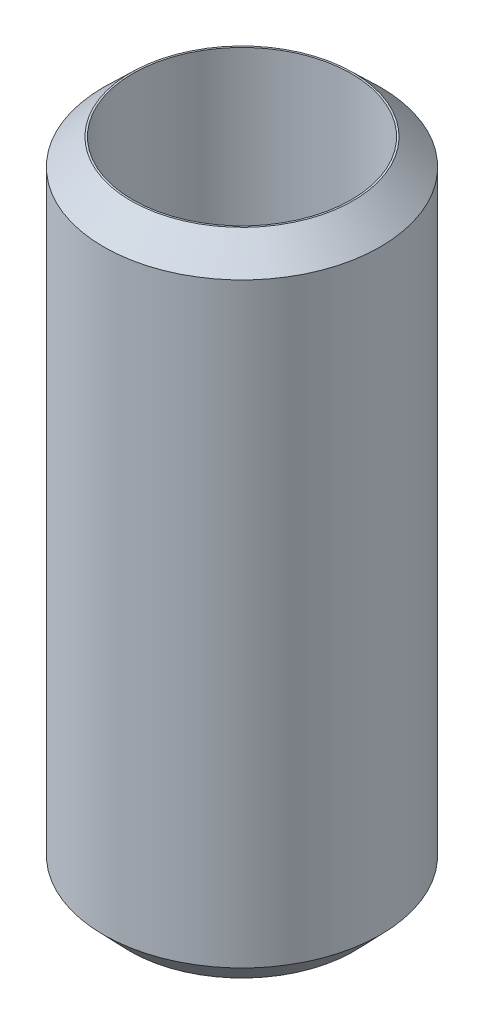
from build123d import *
from OCP.BRepFilletAPI import BRepFilletAPI_MakeChamfer

# Parameters (mm, degrees)
SKETCH1_R           = 22.5
BOSS_EXTRUDE1_DEPTH = 105.611413284
SKETCH2_R           = 17.778612409
CUT_EXTRUDE1_DEPTH  = 111.300818745
CHAMFER1_SIZE       = 4.272780379
CHAMFER1_SIZE2      = 4.43582199


with BuildPart() as part:
    # Sketch1 → Boss-Extrude1 (new body)
    with BuildSketch(Plane(origin=(0, 0, 0), x_dir=(1, 0, 0), z_dir=(0, 1, 0))):
        Circle(SKETCH1_R)
    extrude(amount=BOSS_EXTRUDE1_DEPTH)

    # Sketch2 → Cut-Extrude1 (cut, through all)
    with BuildSketch(Plane(origin=(0, 0, 0), x_dir=(1, 0, 0), z_dir=(0, 1, 0))):
        Circle(SKETCH2_R)
    extrude(amount=CUT_EXTRUDE1_DEPTH, mode=Mode.SUBTRACT)

    # Chamfer1: one chamfer whose edges measure the first distance from different faces: ONE call of the kernel's chamfer builder (chamfer() names one face for all edges)
    chamfer1_edges_1 = [part.edges().sort_by_distance(p)[0] for p in [
        (-22.5, 105.611413284, 0),
    ]]
    chamfer1_side_1 = [part.faces().sort_by_distance(p)[0] for p in [
        (-22.5, 52.805706642, 0),
    ]]
    chamfer1_edges_2 = [part.edges().sort_by_distance(p)[0] for p in [
        (-22.5, 0, 0),
    ]]
    chamfer1_side_2 = [part.faces().sort_by_distance(p)[0] for p in [
        (-21.863603897, 0, 0),
    ]]
    chamfer1 = BRepFilletAPI_MakeChamfer(part.part.solid().wrapped)
    for e in chamfer1_edges_1:
        chamfer1.Add(CHAMFER1_SIZE, CHAMFER1_SIZE2, e.wrapped, chamfer1_side_1[0].wrapped)  # the first distance lies on this face
    for e in chamfer1_edges_2:
        chamfer1.Add(CHAMFER1_SIZE, CHAMFER1_SIZE2, e.wrapped, chamfer1_side_2[0].wrapped)  # the first distance lies on this face
    add(Compound.cast(chamfer1.Shape()), mode=Mode.REPLACE)


solid = part.part
